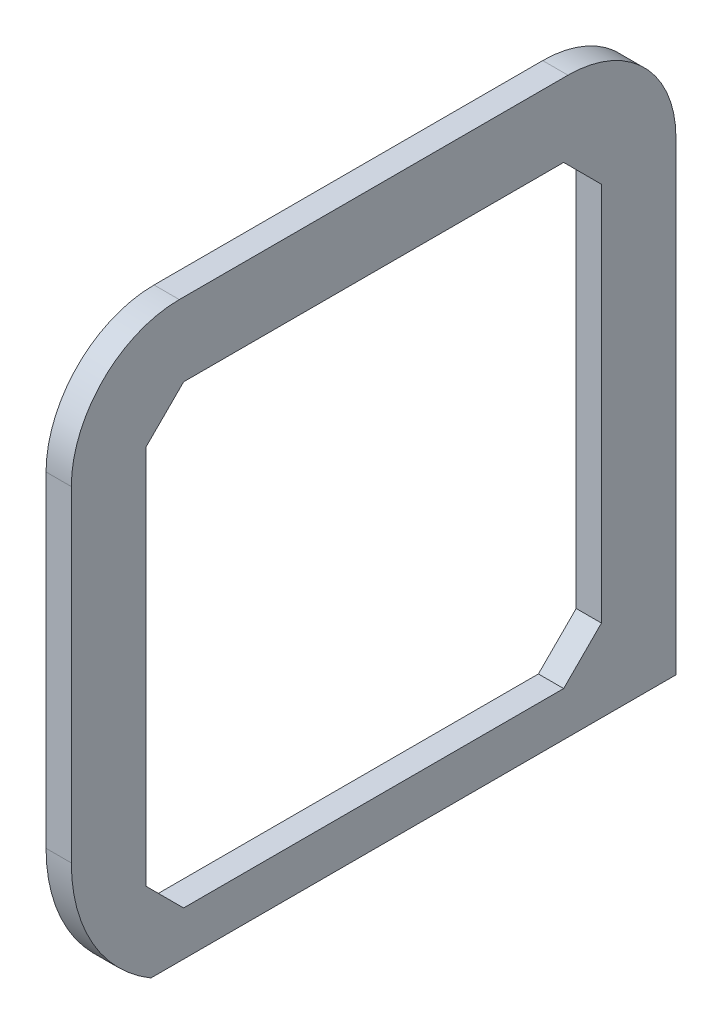
from build123d import *

# Parameters (mm, degrees)
BOSS_EXTRUDE1_DEPTH = 56
SKETCH14_W          = 42.2
SKETCH14_H          = 42.2
CUT_EXTRUDE1_DEPTH  = 56
CHAMFER1_SIZE       = 3.5
FILLET1_R           = 10
SKETCH16_W          = 12.4
SKETCH16_H          = 23
CUT_EXTRUDE3_DEPTH  = 95.009532523
CUT_EXTRUDE4_REACH  = 93.39
SKETCH17_W          = 15.453545708
SKETCH17_H          = 18
FILLET4_R           = 15
CUT_EXTRUDE5_DEPTH  = 92.389771857


with BuildPart() as part:
    # Sketch1 → Boss-Extrude1 (new body)
    with BuildSketch(Plane.XY):
        with BuildLine():
            Line((13.02, -7.9417418), (17.7, -7.9417418))
            Line((17.7, -7.9417418), (17.7, 70.02))
            Line((17.7, 70.02), (-10.566443095, 70.02))
            Line((-10.566443095, 70.02), (-10.566443095, 13.02))
            Line((-10.566443095, 13.02), (-5.317126718, 13.02))
            Line((-5.317126718, 13.02), (-4.287512407, 13.02))
            ThreePointArc((-4.287512407, 13.02), (-3.319474451, 12.619025549), (-2.9185, 11.650987593))
            Line((-2.9185, 11.650987593), (-2.9185, 11.539212407))
            ThreePointArc((-2.9185, 11.539212407), (-3.319474451, 10.571174451), (-4.287512407, 10.1702))
            Line((-4.287512407, 10.1702), (-6.476788598, 10.1702))
            ThreePointArc((-6.476788598, 10.1702), (-7.136510935, 9.729114651), (-6.981020848, 8.950903446))
            Line((-6.981020848, 8.950903446), (-3.672257405, 5.649701928))
            ThreePointArc((-3.672257405, 5.649701928), (-2.746830644, 5.032499411), (-1.655778399, 4.8158))
            Line((-1.655778399, 4.8158), (1.655778399, 4.8158))
            ThreePointArc((1.655778399, 4.8158), (2.746830644, 5.032499411), (3.672257405, 5.649701928))
            Line((3.672257405, 5.649701928), (6.981020848, 8.950903446))
            ThreePointArc((6.981020848, 8.950903446), (7.136510935, 9.729114651), (6.476788598, 10.1702))
            Line((6.476788598, 10.1702), (4.287512407, 10.1702))
            ThreePointArc((4.287512407, 10.1702), (3.319474451, 10.571174451), (2.9185, 11.539212407))
            Line((2.9185, 11.539212407), (2.9185, 11.650987593))
            ThreePointArc((2.9185, 11.650987593), (3.319474451, 12.619025549), (4.287512407, 13.02))
            Line((4.287512407, 13.02), (6.332886163, 13.02))
            Line((6.332886163, 13.02), (10.562594215, 13.019824354))
            ThreePointArc((10.562594215, 13.019824354), (12.303594776, 12.313982883), (13.019956614, 10.577284622))
            Line((13.019956614, 10.577284622), (13.02, 4.287469289))
            ThreePointArc((13.02, 4.287469289), (12.619025549, 3.319431332), (11.650987593, 2.918456882))
            Line((11.650987593, 2.918456882), (11.539212407, 2.918456882))
            ThreePointArc((11.539212407, 2.918456882), (10.571174451, 3.319431332), (10.1702, 4.287469289))
            Line((10.1702, 4.287469289), (10.1702, 6.402089023))
            ThreePointArc((10.1702, 6.402089023), (9.733877283, 7.055496588), (8.963146507, 6.90287605))
            Line((8.963146507, 6.90287605), (5.667020993, 3.614283579))
            ThreePointArc((5.667020993, 3.614283579), (5.046449321, 2.687255303), (4.8285, 1.593185507))
            Line((4.8285, 1.593185507), (4.8285, -1.593185507))
            ThreePointArc((4.8285, -1.593185507), (5.046449321, -2.687255303), (5.667020993, -3.614283579))
            Line((5.667020993, -3.614283579), (8.963146507, -6.90287605))
            ThreePointArc((8.963146507, -6.90287605), (9.733877283, -7.055496588), (10.1702, -6.402089023))
            Line((10.1702, -6.402089023), (10.1702, -4.287469289))
            ThreePointArc((10.1702, -4.287469289), (10.571174451, -3.319431332), (11.539212407, -2.918456882))
            Line((11.539212407, -2.918456882), (11.650987593, -2.918456882))
            ThreePointArc((11.650987593, -2.918456882), (12.619025549, -3.319431332), (13.02, -4.287469289))
            Line((13.02, -4.287469289), (13.02, -5.3170836))
            Line((13.02, -5.3170836), (13.02, -7.9417418))
        make_face()
    extrude(amount=BOSS_EXTRUDE1_DEPTH)

    # Sketch14 → Cut-Extrude1 (cut)
    with BuildSketch(Plane(origin=(17.7, 0, 0), x_dir=(0, 0, -1), z_dir=(1, 0, 0))):
        with Locations((-28, 42.12)):
            Rectangle(SKETCH14_W, SKETCH14_H)
    extrude(amount=-CUT_EXTRUDE1_DEPTH, mode=Mode.SUBTRACT)

    # Chamfer1
    chamfer1_edges = [part.edges().sort_by_distance(p)[0] for p in [
        (3.566778452, 21.02, 49.1),
        (3.566778452, 63.22, 49.1),
        (3.566778452, 63.22, 6.9),
        (3.566778452, 21.02, 6.9),
    ]]
    chamfer(chamfer1_edges, length=CHAMFER1_SIZE)

    # Fillet1
    fillet1_edges = [part.edges().sort_by_distance(p)[0] for p in [
        (3.566778452, 70.02, 56),
        (3.566778452, 70.02, 0),
    ]]
    fillet(fillet1_edges, radius=FILLET1_R)

    # Sketch16 → Cut-Extrude3 (cut, through all)
    with BuildSketch(Plane(origin=(17.7, 0, 0), x_dir=(0, 0, -1), z_dir=(1, 0, 0))):
        with Locations((-49.8, 3.5582582)):
            Rectangle(SKETCH16_W, SKETCH16_H)
    extrude(amount=-CUT_EXTRUDE3_DEPTH, mode=Mode.SUBTRACT)

    # Sketch17 → Cut-Extrude4 (cut, up to next)
    with BuildSketch(Plane.XY.offset(56), mode=Mode.PRIVATE) as cut_extrude4_sk1:
        with Locations((-5.893215949, 42.12)):
            Rectangle(SKETCH17_W, SKETCH17_H)
    cut_extrude4_tool1 = extrude(cut_extrude4_sk1.sketch, amount=-CUT_EXTRUDE4_REACH, mode=Mode.PRIVATE) & part.part
    add(cut_extrude4_tool1.solids().sort_by_distance((-5.893216, 42.12, 56))[0], mode=Mode.SUBTRACT)

    # Fillet4
    # the kernel refuses this fillet: 15 mm, written as the material it takes off along each edge
    with BuildSketch(Plane(origin=(54.632370625, 15.0582582, 56), x_dir=(0, 1, 0), z_dir=(-1, 0, 0))) as fillet4_piece_1:
        with BuildLine():
            CenterArc((14.77294825, 15), FILLET4_R, 189.98168298, 80.01831702)
            Line((0, 12.4), (-0.295458965, 12.348))
            ThreePointArc((-0.295458965, 12.348), (-0.3, 6.2), (-0.3, 0))
            Line((-0.3, 0), (0, -0.3))
            Line((0, -0.3), (14.77294825, -0.3))
            Line((14.77294825, -0.3), (14.77294825, 0))
        make_face()
    extrude(amount=102.131184346, mode=Mode.SUBTRACT)

    # Sketch18 → Cut-Extrude5 (cut, through all)
    with BuildSketch(Plane(origin=(0, 0, 0), x_dir=(-1, 0, 0), z_dir=(0, 0, -1))):
        Polygon((-15.359697471, 16.914250509), (-37.368077548, 16.914250509), (-37.368077548, -12.201573967), (-15.359697471, -12.201573967), (14.082488106, -12.201573967), (14.082488106, 72.835801267), (-15.359697471, 72.835801267), align=None)
    extrude(amount=-CUT_EXTRUDE5_DEPTH, mode=Mode.SUBTRACT)


solid = part.part
